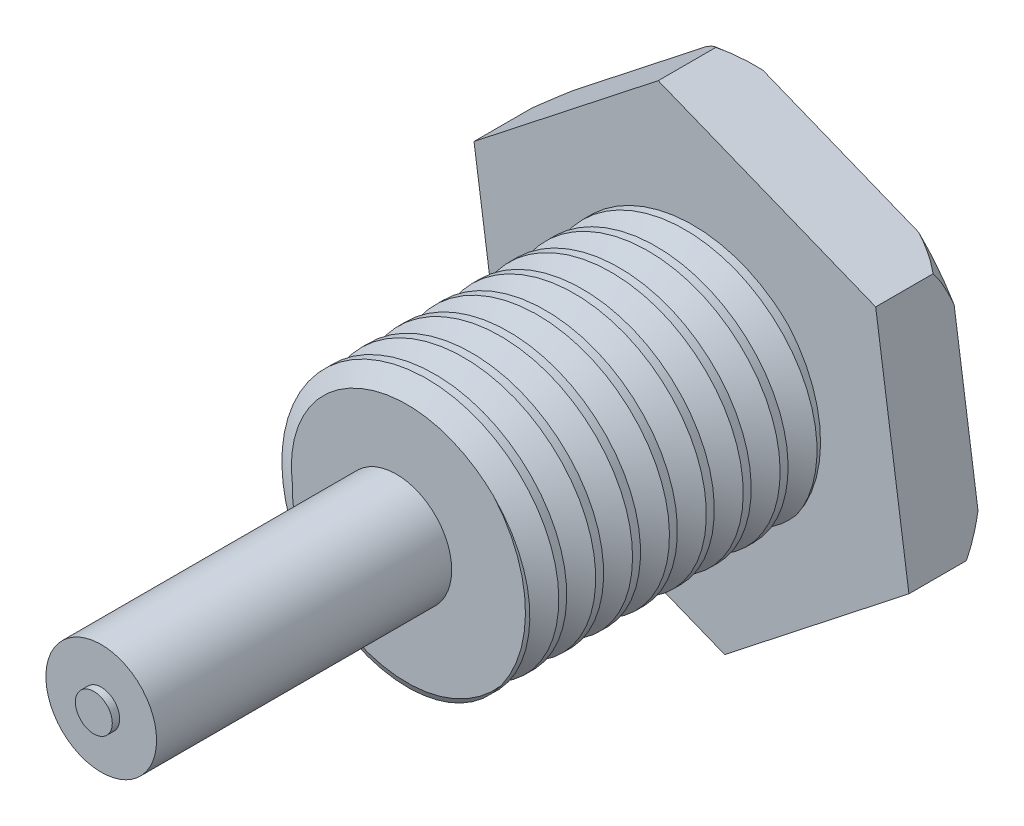
from build123d import *

# Parameters (mm, degrees)
SKETCH1_R           = 0.875
BOSS_EXTRUDE1_DEPTH = 2
BOSS_EXTRUDE2_DEPTH = 0.5
SKETCH3_R           = 0.375
BOSS_EXTRUDE3_DEPTH = 2
CUT_SWEEP1_PITCH    = 0.25
CUT_SWEEP1_TO       = 2
SKETCH5_R           = 0.125
BOSS_EXTRUDE5_DEPTH = 0.05


with BuildPart() as part:
    # Sketch1 → Boss-Extrude1 (new body)
    with BuildSketch(Plane.XY):
        Circle(SKETCH1_R)
    extrude(amount=BOSS_EXTRUDE1_DEPTH)

    # Sketch2 → Boss-Extrude2 (add)
    with BuildSketch(Plane(origin=(0, 0, 0), x_dir=(-1, 0, 0), z_dir=(0, 0, -1))):
        Polygon((-0.225266713, -1.571651438), (1.248456714, -0.980912415), (1.473723427, 0.590739023), (0.225266713, 1.571651438), (-1.248456714, 0.980912415), (-1.473723427, -0.590739023), align=None)
    extrude(amount=BOSS_EXTRUDE2_DEPTH)

    # Sketch3 → Boss-Extrude3 (add)
    with BuildSketch(Plane.XY.offset(2)):
        Circle(SKETCH3_R)
    extrude(amount=BOSS_EXTRUDE3_DEPTH)

    # Cut-Sweep1: arcs per turn and ends read off the stored shape
    # Cut-Sweep1: the profile of Sketch6 screwed along a right-hand helix through 9.666667 turns, 6 arcs to a turn; built about Z, then put on its axis
    cut_sweep1_z = Axis((0, 0, 0), (0, 0, 1))
    cut_sweep1_corners = [(0.705267688, -9.0371e-05, -0.248012638), (0.895793277, -0.00508722, -0.13812619), (0.895793277, 0.004906478, -0.357899086)]
    with BuildLine(mode=Mode.PRIVATE) as cut_sweep1_profile:
        Line(cut_sweep1_corners[0], cut_sweep1_corners[1])
        Line(cut_sweep1_corners[1], cut_sweep1_corners[2])
        Line(cut_sweep1_corners[2], cut_sweep1_corners[0])
    cut_sweep1_cap = Face(cut_sweep1_profile.wire())
    cut_sweep1_turn_angles = [0, 30, 60, 90, 120, 150, 180, 210, 240, 270, 300, 330, 360]
    cut_sweep1_turn_weights = [1, 0.8660254037844387, 1, 0.8660254037844387, 1, 0.8660254037844387, 1, 0.8660254037844387, 1, 0.8660254037844387, 1, 0.8660254037844387, 1]
    cut_sweep1_turn_rails = [Edge.make_bspline([Vector(p[0], p[1], 0).rotate(cut_sweep1_z, cut_sweep1_turn_angles[k]) / cut_sweep1_turn_weights[k] + Vector(0, 0, p[2] + CUT_SWEEP1_PITCH * cut_sweep1_turn_angles[k] / 360) for k in range(13)], [0, 0, 0, 1, 1, 2, 2, 3, 3, 4, 4, 5, 5, 6, 6, 6], 2, cut_sweep1_turn_weights) for p in cut_sweep1_corners]
    cut_sweep1_turn_sides = [Face.make_surface_from_curves(cut_sweep1_turn_rails[p[0]], cut_sweep1_turn_rails[p[1]]) for p in [(0, 1), (1, 2), (2, 0)]]
    cut_sweep1_last_angles = [3240, 3270, 3300, 3330, 3360, 3390, 3420, 3450, 3480]
    cut_sweep1_last_weights = [1, 0.8660254037844387, 1, 0.8660254037844387, 1, 0.8660254037844387, 1, 0.8660254037844387, 1]
    cut_sweep1_last_rails = [Edge.make_bspline([Vector(p[0], p[1], 0).rotate(cut_sweep1_z, cut_sweep1_last_angles[k]) / cut_sweep1_last_weights[k] + Vector(0, 0, p[2] + CUT_SWEEP1_PITCH * cut_sweep1_last_angles[k] / 360) for k in range(9)], [0, 0, 0, 1, 1, 2, 2, 3, 3, 4, 4, 4], 2, cut_sweep1_last_weights) for p in cut_sweep1_corners]
    cut_sweep1_last_sides = [Face.make_surface_from_curves(cut_sweep1_last_rails[p[0]], cut_sweep1_last_rails[p[1]]) for p in [(0, 1), (1, 2), (2, 0)]]
    cut_sweep1 = Plane(origin=(0, 0, 2), x_dir=(-1, 0, 0), z_dir=(0, 0, -1)) * split(Solid(Shell([*[p.moved(Location((0, 0, CUT_SWEEP1_PITCH * i))) for i in range(9) for p in cut_sweep1_turn_sides], *cut_sweep1_last_sides, cut_sweep1_cap, cut_sweep1_cap.rotate(cut_sweep1_z, 3480).moved(Location((0, 0, CUT_SWEEP1_PITCH * 3480 / 360)))])), bisect_by=Plane.XY.offset(CUT_SWEEP1_TO), keep=Keep.BOTTOM, mode=Mode.PRIVATE)
    add(cut_sweep1, mode=Mode.SUBTRACT)

    # Sketch5 → Boss-Extrude5 (add)
    with BuildSketch(Plane.XY.offset(4)):
        Circle(SKETCH5_R)
    extrude(amount=BOSS_EXTRUDE5_DEPTH)

    # Cut-Sweep2: sweep along a path in Sketch7
    with BuildLine(Plane(origin=(0, 0, -0.5), x_dir=(-1, 0, 0), z_dir=(0, 0, -1))) as cut_sweep2_path:
        CenterArc((0, 0), 1.58771324, 0, 360)
    # Sketch8 → Cut-Sweep2 (sweep, cut)
    with BuildSketch(Plane(origin=(0, 0, 0), x_dir=(0.7863238038255569, 0.6178145964100454, 0), z_dir=(-0.6178145964100453, 0.7863238038255568, 0))):
        with BuildLine():
            Line((-1.348117105, 0.579551851), (-1.636828162, 0.579551851))
            Line((-1.636828162, 0.579551851), (-1.636828162, 0.280646837))
            add(Edge.make_bspline(
                [(-1.636828162, 0.280646837), (-1.618959052, 0.390815983), (-1.461779972, 0.554426465), (-1.348117105, 0.579551851)],
                knots=[0, 0, 0, 0, 1, 1, 1, 1], degree=3))
        make_face()
    sweep(path=cut_sweep2_path.line, mode=Mode.SUBTRACT)


solid = part.part
